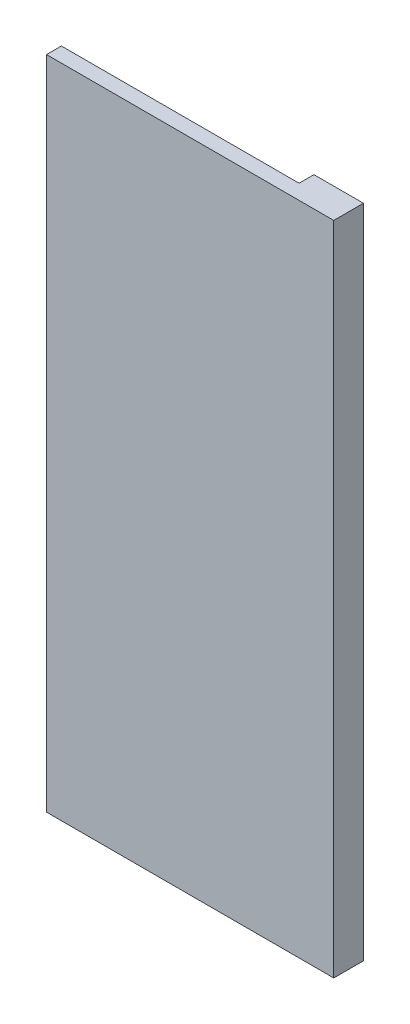
from build123d import *

# Parameters (mm, degrees)
BOSS_EXTRUDE1_DEPTH = 6
SKETCH2_W           = 116
SKETCH2_H           = 265
BOSS_EXTRUDE2_DEPTH = 6


with BuildPart() as part:
    # Sketch1 → Boss-Extrude1 (new body)
    with BuildSketch(Plane.XY):
        Polygon((68, 245), (48, 245), (48, 0), (-48, 0), (-48, -20), (68, -20), align=None)
    extrude(amount=-BOSS_EXTRUDE1_DEPTH)

    # Sketch2 → Boss-Extrude2 (add)
    with BuildSketch(Plane.XY):
        with Locations((10, 112.5)):
            Rectangle(SKETCH2_W, SKETCH2_H)
    extrude(amount=BOSS_EXTRUDE2_DEPTH)


solid = part.part
